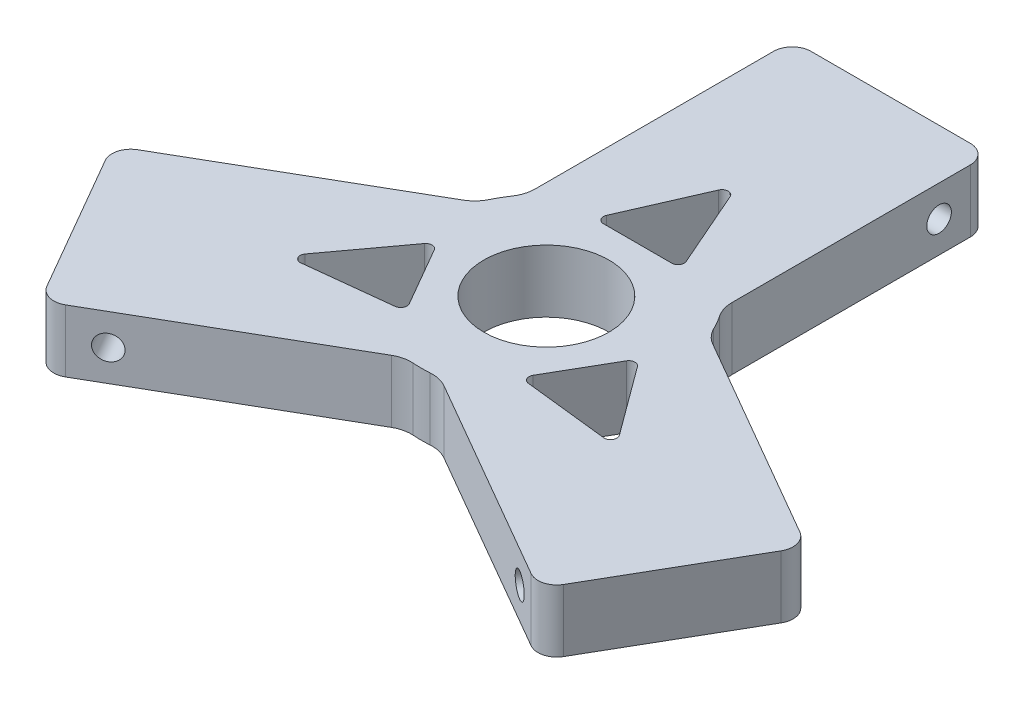
from build123d import *

# Parameters (mm, degrees)
BOSS_EXTRUDE1_DEPTH      = 6.35
M3X0_5_TAPPED_HOLE2_D    = 2.5
M3X0_5_TAPPED_HOLE3_D    = 2.5
M3X0_5_TAPPED_HOLE4_D    = 2.5
FILLET1_R                = 3.175
SKETCH10_R               = 6.36
CUT_EXTRUDE1_DEPTH       = 51.121665887
CUT_EXTRUDE2_DEPTH       = 51.121665887
FILLET2_R                = 0.635
CIRPATTERN1_COUNT        = 2
CIRPATTERN1_ANGLE        = 120
FILLET2_OF_CIRPATTERN1_R = 0.635
CIRPATTERN5_COUNT        = 2
CIRPATTERN5_ANGLE        = 240
FILLET2_OF_CIRPATTERN5_R = 0.635
FILLET3_R                = 1.905


with BuildPart() as part:
    # Sketch1 → Boss-Extrude1 (new body)
    with BuildSketch(Plane(origin=(0, 0, 0), x_dir=(1, 0, 0), z_dir=(0, 1, 0))):
        with BuildLine():
            Line((0, 35), (10, 35))
            Line((10, 35), (10, 7.82879301))
            ThreePointArc((10, 7.82879301), (10.995187387, 6.355773306), (11.774944022, 4.758223752))
            Line((11.774944022, 4.758223752), (35.310889132, -8.839745962))
            Line((35.310889132, -8.839745962), (30.310889132, -17.5))
            Line((30.310889132, -17.5), (25.310889132, -26.160254038))
            Line((25.310889132, -26.160254038), (1.779933628, -12.574650543))
            ThreePointArc((1.779933628, -12.574650543), (0, -12.7), (-1.779933628, -12.574650543))
            Line((-1.779933628, -12.574650543), (-25.310889132, -26.160254038))
            Line((-25.310889132, -26.160254038), (-30.310889132, -17.5))
            Line((-30.310889132, -17.5), (-35.310889132, -8.839745962))
            Line((-35.310889132, -8.839745962), (-11.779933628, 4.745857533))
            ThreePointArc((-11.779933628, 4.745857533), (-10.998522628, 6.35), (-10, 7.82879301))
            Line((-10, 7.82879301), (-10, 35))
            Line((-10, 35), (0, 35))
        make_face()
    extrude(amount=BOSS_EXTRUDE1_DEPTH)

    # M3x0.5 Tapped Hole2 (through all)
    with Locations(Plane(origin=(10, 0, 0), x_dir=(0, 0, -1), z_dir=(1, 0, 0))):
        with Locations((29.92, 3.175)):
            Hole(M3X0_5_TAPPED_HOLE2_D / 2)

    # M3x0.5 Tapped Hole3 (through all)
    with Locations(Plane(origin=(-5, 0, -8.660254038), x_dir=(-0.8660254037844434, 0, 0.499999999999992), z_dir=(-0.499999999999992, 0, -0.8660254037844434))):
        with Locations((29.92, 3.175)):
            Hole(M3X0_5_TAPPED_HOLE3_D / 2)

    # M3x0.5 Tapped Hole4 (through all)
    with Locations(Plane(origin=(-5, 0, 8.660254038), x_dir=(0.8660254037844398, 0, 0.49999999999999795), z_dir=(-0.49999999999999795, 0, 0.8660254037844398))):
        with Locations((29.92, 3.175)):
            Hole(M3X0_5_TAPPED_HOLE4_D / 2)

    # Fillet1
    fillet1_edges = [part.edges().sort_by_distance(p)[0] for p in [
        (-11.779933628, 3.175, -4.745857533),
        (-10, 3.175, -7.82879301),
        (-1.779933628, 3.175, 12.574650543),
        (1.779933628, 3.175, 12.574650543),
        (11.774944022, 3.175, -4.758223752),
        (10, 3.175, -7.82879301),
    ]]
    fillet(fillet1_edges, radius=FILLET1_R)

    # Sketch10 → Cut-Extrude1 (cut, through all)
    with BuildSketch(Plane(origin=(0, 6.35, 0), x_dir=(1, 0, 0), z_dir=(0, 1, 0))):
        Circle(SKETCH10_R)
    extrude(amount=-CUT_EXTRUDE1_DEPTH, mode=Mode.SUBTRACT)

    # Sketch11 → Cut-Extrude2 (cut, through all)
    with BuildSketch(Plane(origin=(0, 6.35, 0), x_dir=(1, 0, 0), z_dir=(0, 1, 0))):
        Polygon((0, 19.432672172), (-4.445, 9.272672172), (4.445, 9.272672172), align=None)
    cut_extrude2 = extrude(amount=-CUT_EXTRUDE2_DEPTH, mode=Mode.SUBTRACT)

    # Fillet2
    fillet2_edges = [part.edges().sort_by_distance(p)[0] for p in [
        (-4.445, 3.175, -9.272672172),
        (4.445, 3.175, -9.272672172),
        (0, 3.175, -19.432672172),
    ]]
    fillet(fillet2_edges, radius=FILLET2_R)

    # CirPattern1: Cut-Extrude2 ×2 about axis
    cirpattern1_axis = Axis((0, 6.35, 0), (0, 1, 0))
    for i in range(1, CIRPATTERN1_COUNT):
        add(cut_extrude2.rotate(cirpattern1_axis, i * CIRPATTERN1_ANGLE / (CIRPATTERN1_COUNT - 1)), mode=Mode.SUBTRACT)

    # Fillet2 of CirPattern1
    fillet2_of_cirpattern1_edges = [part.edges().sort_by_distance(p)[0] for p in [
        (-5.807869662, 3.175, 8.485819006),
        (-10.252869662, 3.175, 0.786853166),
        (-16.829187764, 3.175, 9.716336086),
    ]]
    fillet(fillet2_of_cirpattern1_edges, radius=FILLET2_OF_CIRPATTERN1_R)

    # CirPattern5: Cut-Extrude2 ×2 about axis
    cirpattern5_axis = Axis((0, 6.35, 0), (0, 1, 0))
    for i in range(1, CIRPATTERN5_COUNT):
        add(cut_extrude2.rotate(cirpattern5_axis, i * CIRPATTERN5_ANGLE / (CIRPATTERN5_COUNT - 1)), mode=Mode.SUBTRACT)

    # Fillet2 of CirPattern5
    fillet2_of_cirpattern5_edges = [part.edges().sort_by_distance(p)[0] for p in [
        (10.252869662, 3.175, 0.786853166),
        (5.807869662, 3.175, 8.485819006),
        (16.829187764, 3.175, 9.716336086),
    ]]
    fillet(fillet2_of_cirpattern5_edges, radius=FILLET2_OF_CIRPATTERN5_R)

    # Fillet3
    fillet3_edges = [part.edges().sort_by_distance(p)[0] for p in [
        (25.310889132, 3.175, 26.160254038),
        (35.310889132, 3.175, 8.839745962),
        (10, 3.175, -35),
        (-10, 3.175, -35),
        (-35.310889132, 3.175, 8.839745962),
        (-25.310889132, 3.175, 26.160254038),
    ]]
    fillet(fillet3_edges, radius=FILLET3_R)


solid = part.part
